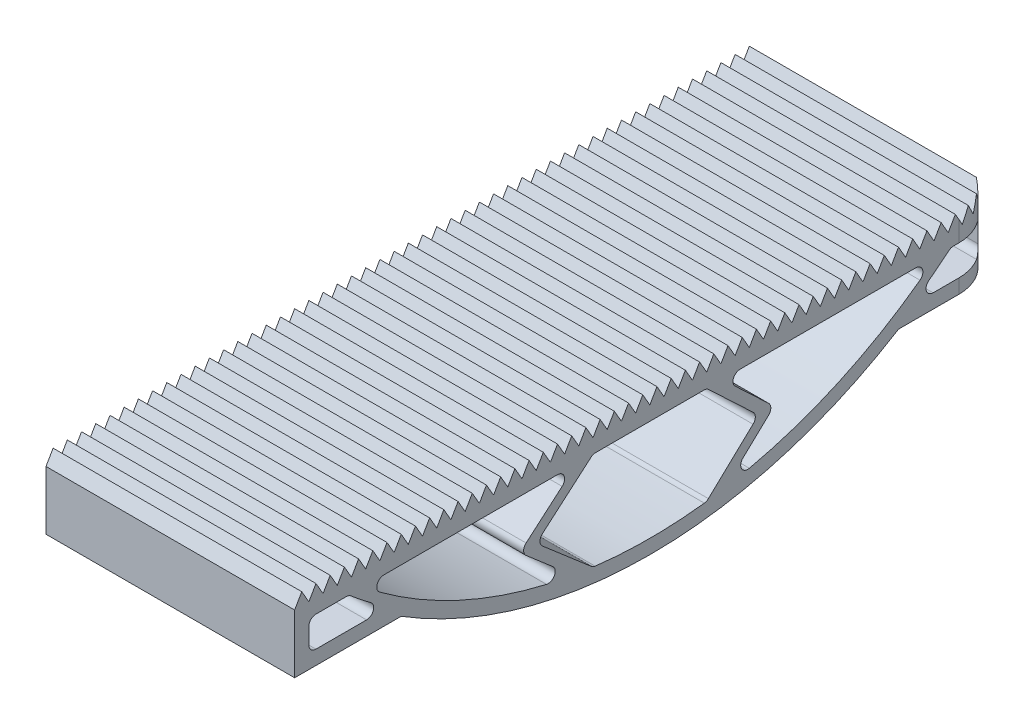
from build123d import *

# Parameters (mm, degrees)
SKETCH1_W           = 35
SKETCH1_H           = 100
BOSS_EXTRUDE1_DEPTH = 10
CUT_EXTRUDE1_DEPTH  = 107.418983269
LPATTERN1_DEPTH     = 35
BOSS_EXTRUDE3_DEPTH = 35
FILLET1_R           = 6.5
CUT_EXTRUDE2_START  = -35
CUT_EXTRUDE2_DEPTH  = 35
FILLET2_R           = 1


# Read off the part's stored shape, not the designer's step: LPattern1, Cut-Extrude2
with BuildPart() as part:
    # Sketch1 → Boss-Extrude1 (new body)
    with BuildSketch(Plane(origin=(0, 0, 0), x_dir=(1, 0, 0), z_dir=(0, 1, 0))):
        with Locations((17.5, 50)):
            Rectangle(SKETCH1_W, SKETCH1_H)
    extrude(amount=BOSS_EXTRUDE1_DEPTH)

    # Sketch3 → Cut-Extrude1 (cut, through all)
    with BuildSketch(Plane.ZY):
        Polygon((-99, 10), (-98, 8.267949192), (-97, 10), align=None)
    extrude(amount=-CUT_EXTRUDE1_DEPTH, mode=Mode.SUBTRACT)

    # LPattern1 outline → LPattern1 (cut)
    with BuildSketch(Plane.YZ):
        Polygon((10, -100), (10, -99), (8.267949192, -100), align=None)
        Polygon((10, -97), (10, -95), (8.267949192, -96), align=None)
        Polygon((8.267949192, 0), (10, -1), (10, 0), align=None)
        Polygon((8.267949192, -2), (10, -3), (10, -1), align=None)
        Polygon((8.267949192, -4), (10, -5), (10, -3), align=None)
        Polygon((8.267949192, -6), (10, -7), (10, -5), align=None)
        Polygon((8.267949192, -8), (10, -9), (10, -7), align=None)
        Polygon((8.267949192, -10), (10, -11), (10, -9), align=None)
        Polygon((8.267949192, -12), (10, -13), (10, -11), align=None)
        Polygon((8.267949192, -14), (10, -15), (10, -13), align=None)
        Polygon((8.267949192, -16), (10, -17), (10, -15), align=None)
        Polygon((8.267949192, -18), (10, -19), (10, -17), align=None)
        Polygon((8.267949192, -20), (10, -21), (10, -19), align=None)
        Polygon((8.267949192, -22), (10, -23), (10, -21), align=None)
        Polygon((8.267949192, -24), (10, -25), (10, -23), align=None)
        Polygon((8.267949192, -26), (10, -27), (10, -25), align=None)
        Polygon((8.267949192, -28), (10, -29), (10, -27), align=None)
        Polygon((8.267949192, -30), (10, -31), (10, -29), align=None)
        Polygon((8.267949192, -32), (10, -33), (10, -31), align=None)
        Polygon((8.267949192, -34), (10, -35), (10, -33), align=None)
        Polygon((8.267949192, -36), (10, -37), (10, -35), align=None)
        Polygon((8.267949192, -38), (10, -39), (10, -37), align=None)
        Polygon((8.267949192, -40), (10, -41), (10, -39), align=None)
        Polygon((8.267949192, -42), (10, -43), (10, -41), align=None)
        Polygon((8.267949192, -44), (10, -45), (10, -43), align=None)
        Polygon((8.267949192, -46), (10, -47), (10, -45), align=None)
        Polygon((8.267949192, -48), (10, -49), (10, -47), align=None)
        Polygon((8.267949192, -50), (10, -51), (10, -49), align=None)
        Polygon((8.267949192, -52), (10, -53), (10, -51), align=None)
        Polygon((8.267949192, -54), (10, -55), (10, -53), align=None)
        Polygon((8.267949192, -56), (10, -57), (10, -55), align=None)
        Polygon((8.267949192, -58), (10, -59), (10, -57), align=None)
        Polygon((8.267949192, -60), (10, -61), (10, -59), align=None)
        Polygon((8.267949192, -62), (10, -63), (10, -61), align=None)
        Polygon((8.267949192, -64), (10, -65), (10, -63), align=None)
        Polygon((8.267949192, -66), (10, -67), (10, -65), align=None)
        Polygon((8.267949192, -68), (10, -69), (10, -67), align=None)
        Polygon((8.267949192, -70), (10, -71), (10, -69), align=None)
        Polygon((8.267949192, -72), (10, -73), (10, -71), align=None)
        Polygon((8.267949192, -74), (10, -75), (10, -73), align=None)
        Polygon((8.267949192, -76), (10, -77), (10, -75), align=None)
        Polygon((8.267949192, -78), (10, -79), (10, -77), align=None)
        Polygon((8.267949192, -80), (10, -81), (10, -79), align=None)
        Polygon((8.267949192, -82), (10, -83), (10, -81), align=None)
        Polygon((8.267949192, -84), (10, -85), (10, -83), align=None)
        Polygon((8.267949192, -86), (10, -87), (10, -85), align=None)
        Polygon((8.267949192, -88), (10, -89), (10, -87), align=None)
        Polygon((8.267949192, -90), (10, -91), (10, -89), align=None)
        Polygon((8.267949192, -92), (10, -93), (10, -91), align=None)
        Polygon((8.267949192, -94), (10, -95), (10, -93), align=None)
    extrude(amount=LPATTERN1_DEPTH, mode=Mode.SUBTRACT)

    # Sketch5 → Boss-Extrude3 (add)
    with BuildSketch(Plane(origin=(35, 0, 0), x_dir=(0, 0, -1), z_dir=(1, 0, 0))):
        with BuildLine():
            Line((85, 0), (15, 0))
            ThreePointArc((15, 0), (50, -10), (85, 0))
        make_face()
    extrude(amount=-BOSS_EXTRUDE3_DEPTH)

    # Fillet1
    fillet1_edges = [part.edges().sort_by_distance(p)[0] for p in [
        (35, 4.133974596, -100),
    ]]
    fillet(fillet1_edges, radius=FILLET1_R)

    # Cut-Extrude2 outline → Cut-Extrude2 (cut)
    with BuildSketch(Plane(origin=(35, 0, 0), x_dir=(0, 0, -1), z_dir=(1, 0, 0)).offset(CUT_EXTRUDE2_START)):
        with BuildLine():
            Line((98, 2), (98, 6.267949192))
            Line((98, 6.267949192), (92.371488666, 6.267949192))
            ThreePointArc((92.371488666, 6.267949192), (89.617737689, 4.058206439), (86.748958552, 2))
            Line((86.748958552, 2), (98, 2))
        make_face()
        with BuildLine():
            Line((39.700288485, 6.267949192), (9.628511334, 6.267949192))
            ThreePointArc((9.628511334, 6.267949192), (23.568313328, -2.311322045), (39.223600416, -7.08981143))
            Line((39.223600416, -7.08981143), (31.700288485, -0.616025404))
            Line((31.700288485, -0.616025404), (39.700288485, 6.267949192))
        make_face()
        with BuildLine():
            Line((7.628511334, 6.267949192), (2, 6.267949192))
            Line((2, 6.267949192), (2, 2))
            Line((2, 2), (13.251041448, 2))
            ThreePointArc((13.251041448, 2), (10.382262311, 4.058206439), (7.628511334, 6.267949192))
        make_face()
        with BuildLine():
            Line((58, 6.267949192), (42, 6.267949192))
            Line((42, 6.267949192), (34, -0.616025404))
            Line((34, -0.616025404), (42, -7.5))
            ThreePointArc((42, -7.5), (50, -8), (58, -7.5))
            Line((58, -7.5), (65.299033183, -0.616025404))
            Line((65.299033183, -0.616025404), (58, 6.267949192))
        make_face()
        with BuildLine():
            Line((90.371488666, 6.267949192), (60.186206751, 6.267949192))
            Line((60.186206751, 6.267949192), (67.485239933, -0.616025404))
            Line((67.485239933, -0.616025404), (60.587327109, -7.1216893))
            ThreePointArc((60.587327109, -7.1216893), (76.344275109, -2.35069683), (90.371488666, 6.267949192))
        make_face()
    extrude(amount=CUT_EXTRUDE2_DEPTH, mode=Mode.SUBTRACT)

    # Fillet2
    fillet2_edges = [part.edges().sort_by_distance(p)[0] for p in [
        (17.5, -7.1216893, -60.587327109),
        (17.5, -0.616025404, -67.485239933),
        (17.5, 6.267949192, -60.186206751),
        (17.5, 6.267949192, -90.371488666),
        (17.5, -7.5, -42),
        (17.5, -0.616025404, -34),
        (17.5, 6.267949192, -42),
        (17.5, 6.267949192, -58),
        (17.5, -0.616025404, -65.299033183),
        (17.5, -7.5, -58),
        (17.5, 2, -13.251041448),
        (17.5, 2, -2),
        (17.5, 6.267949192, -2),
        (17.5, 6.267949192, -7.628511334),
        (17.5, 6.267949192, -92.371488666),
        (16.59520788, 6.267949192, -98),
        (16.59520788, 2, -98),
        (17.5, 2, -86.748958552),
        (17.5, 6.267949192, -9.628511334),
        (17.5, 6.267949192, -39.700288485),
        (17.5, -0.616025404, -31.700288485),
        (17.5, -7.08981143, -39.223600416),
    ]]
    fillet(fillet2_edges, radius=FILLET2_R)


solid = part.part
